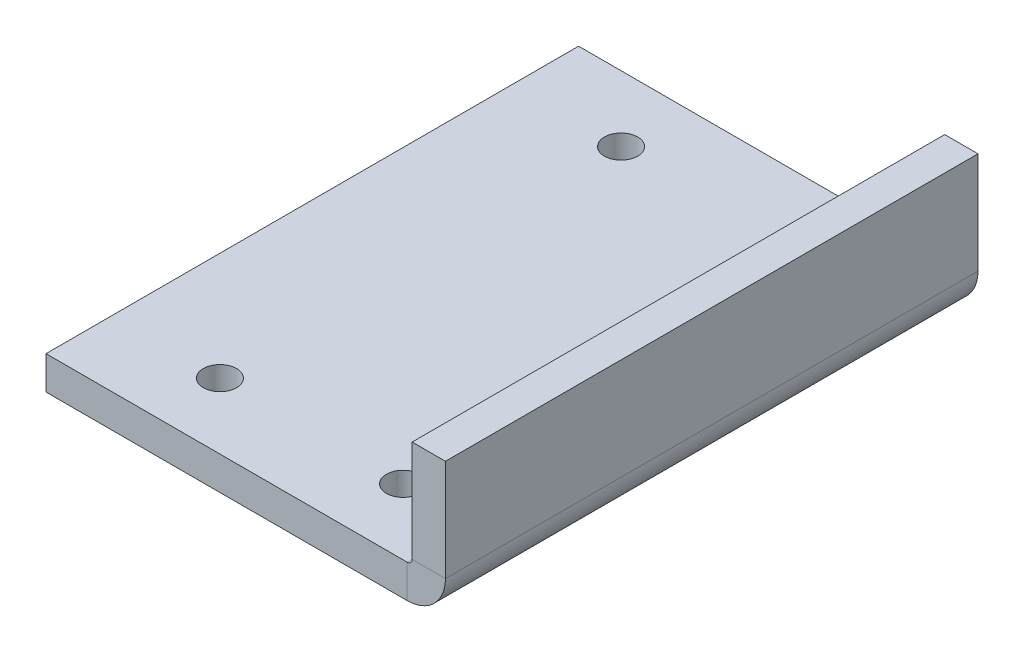
from build123d import *

# Parameters (mm, degrees)
CROQUIS1_W                       = 60
CROQUIS1_H                       = 80
BRIDA_BASE1_DEPTH                = 5
BRIDA_DE_ARISTA1_STRIP_W         = 21.4732
BRIDA_DE_ARISTA1_STRIP_H         = 5
BRIDA_DE_ARISTA1_STRIP_CUT_DEPTH = 80
BRIDA_DE_ARISTA1_DEPTH           = 80
CROQUIS9_R                       = 2.5
CORTAR_EXTRUIR1_DEPTH            = 5


# Sheet-metal steps are written as plain solids
with BuildPart() as part:
    # Croquis1 → Brida base1 (new body)
    with BuildSketch(Plane(origin=(0, 0, 0), x_dir=(1, 0, 0), z_dir=(0, 1, 0))):
        Rectangle(CROQUIS1_W, CROQUIS1_H)
    extrude(amount=-BRIDA_BASE1_DEPTH)

    # Brida de arista1 strip (across the edge) → Brida de arista1 strip cut (cut)
    with BuildSketch(Plane(origin=(30, 0, 40), x_dir=(-1, 0, 0), z_dir=(0, 0, -1))):
        with Locations((-5, -2.5)):
            Rectangle(BRIDA_DE_ARISTA1_STRIP_W, BRIDA_DE_ARISTA1_STRIP_H)
    extrude(amount=BRIDA_DE_ARISTA1_STRIP_CUT_DEPTH, mode=Mode.SUBTRACT)

    # Brida de arista1 section (across the edge) → Brida de arista1 (add)
    with BuildSketch(Plane(origin=(30, 0, 40), x_dir=(-1, 0, 0), z_dir=(0, 0, -1))):
        with BuildLine():
            Line((0, 0.7366), (0, 16))
            Line((0, 16), (5, 16))
            Line((5, 16), (5, 0.7366))
            ThreePointArc((5, 0.7366), (5.215745145, 0.215745145), (5.7366, 0))
            Line((5.7366, 0), (5.7366, -5))
            ThreePointArc((5.7366, -5), (1.680211239, -3.319788761), (0, 0.7366))
        make_face()
    extrude(amount=BRIDA_DE_ARISTA1_DEPTH)

    # Croquis9 → Cortar-Extruir1 (cut)
    with BuildSketch(Plane(origin=(0, 0, 0), x_dir=(1, 0, 0), z_dir=(0, 1, 0))):
        with Locations(Location((-13.75, 30.13, 0), (0, 0, 270))):
            Circle(CROQUIS9_R)
        with Locations(Location((13.75, 30.13, 0), (0, 0, 270))):
            Circle(CROQUIS9_R)
        with Locations(Location((13.75, -30.12, 0), (0, 0, 270))):
            Circle(CROQUIS9_R)
        with Locations(Location((-13.75, -30.12, 0), (0, 0, 270))):
            Circle(CROQUIS9_R)
    extrude(amount=-CORTAR_EXTRUIR1_DEPTH, mode=Mode.SUBTRACT)


solid = part.part
